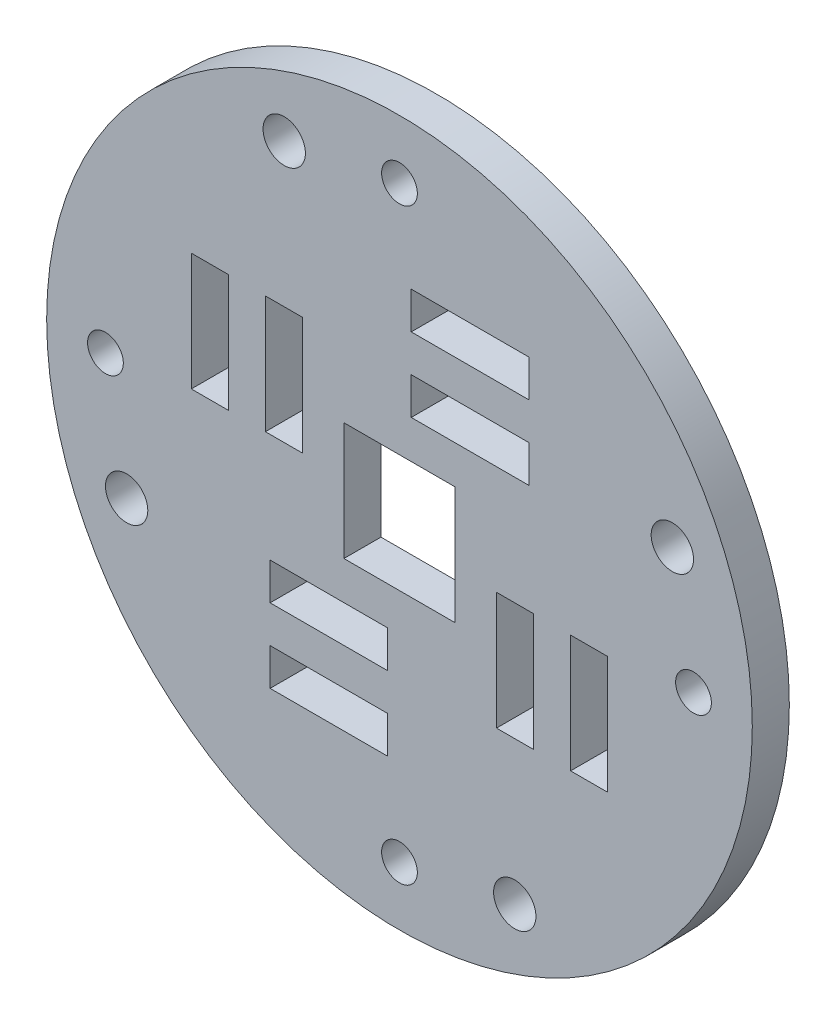
from build123d import *

# Parameters (mm, degrees)
SKETCH1_R           = 38.1
BOSS_EXTRUDE1_DEPTH = 4
SKETCH2_R           = 2.286
SKETCH2_W           = 12.7
SKETCH2_H           = 4
SKETCH2_W_2         = 4
SKETCH2_H_2         = 12.7
CUT_EXTRUDE1_DEPTH  = 55.029806589
CUT_EXTRUDE2_REACH  = 56.03
SKETCH3_W           = 12
SKETCH3_H           = 12.7
SKETCH4_R           = 1.9304
CUT_EXTRUDE3_DEPTH  = 55.029806589


with BuildPart() as part:
    # Sketch1 → Boss-Extrude1 (new body)
    with BuildSketch(Plane.XY):
        Circle(SKETCH1_R)
    extrude(amount=BOSS_EXTRUDE1_DEPTH)

    # Sketch2 → Cut-Extrude1 (cut, through all)
    with BuildSketch(Plane.XY.offset(4)):
        with Locations((12.446, -29.464)):
            Circle(SKETCH2_R)
        with Locations((-29.464, -12.446)):
            Circle(SKETCH2_R)
        with Locations((-12.446, 29.464)):
            Circle(SKETCH2_R)
        with Locations((29.464, 12.446)):
            Circle(SKETCH2_R)
        with Locations((-7.62, -12.478)):
            Rectangle(SKETCH2_W, SKETCH2_H)
        with Locations((12.478, -7.62)):
            Rectangle(SKETCH2_W_2, SKETCH2_H_2)
        with Locations((20.478, -7.62)):
            Rectangle(SKETCH2_W_2, SKETCH2_H_2)
        with Locations((-7.62, -20.478)):
            Rectangle(SKETCH2_W, SKETCH2_H)
        with Locations((-12.478, 7.62)):
            Rectangle(SKETCH2_W_2, SKETCH2_H_2)
        with Locations((-20.478, 7.62)):
            Rectangle(SKETCH2_W_2, SKETCH2_H_2)
        with Locations((7.62, 12.478)):
            Rectangle(SKETCH2_W, SKETCH2_H)
        with Locations((7.62, 20.478)):
            Rectangle(SKETCH2_W, SKETCH2_H)
    extrude(amount=-CUT_EXTRUDE1_DEPTH, mode=Mode.SUBTRACT)

    # Sketch3 → Cut-Extrude2 (cut, up to next)
    with BuildSketch(Plane.XY.offset(4), mode=Mode.PRIVATE) as cut_extrude2_sk1:
        Rectangle(SKETCH3_W, SKETCH3_H)
    cut_extrude2_tool1 = extrude(cut_extrude2_sk1.sketch, amount=-CUT_EXTRUDE2_REACH, mode=Mode.PRIVATE) & part.part
    add(cut_extrude2_tool1.solids().sort_by_distance((0, 0, 4))[0], mode=Mode.SUBTRACT)

    # Sketch4 → Cut-Extrude3 (cut, through all)
    with BuildSketch(Plane.XY.offset(4)):
        with Locations((0, -31.75)):
            Circle(SKETCH4_R)
        with Locations((31.75, 0)):
            Circle(SKETCH4_R)
        with Locations((0, 31.75)):
            Circle(SKETCH4_R)
        with Locations((-31.75, 0)):
            Circle(SKETCH4_R)
    extrude(amount=-CUT_EXTRUDE3_DEPTH, mode=Mode.SUBTRACT)


solid = part.part
